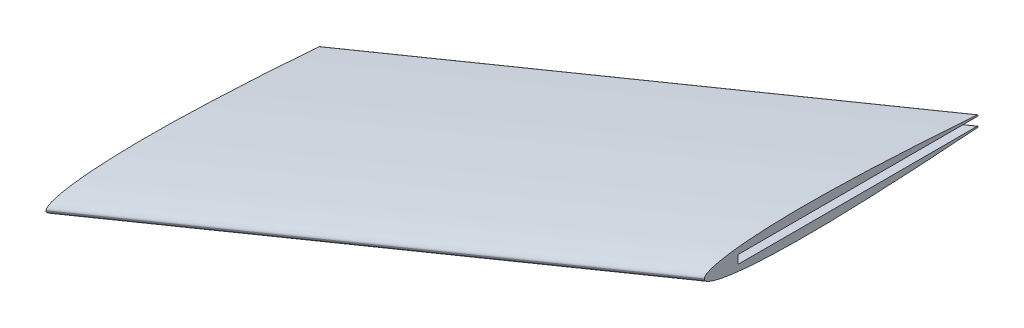
from build123d import *

# Parameters (mm, degrees)
CUT_FIN_SHAPE_BOTTOM_NO_MIDPLANE_DEPTH = 1.5875
CUT_FIN_SHAPE_TOP_NO_MIDPLANE_DEPTH    = 1.5875
FILLET1_R                              = 0.254


with BuildPart() as part:
    # Sketch2 → Loft1 section 0
    with BuildSketch(Plane(origin=(0, 0, 0), x_dir=(0, 0, -1), z_dir=(1, 0, 0))):
        with BuildLine():
            add(Edge.make_bspline(
                [(0, 0), (0.000112065, 0.073439068), (0.010533803, 0.168791942), (0.041645518, 0.288902736), (0.107597774, 0.439525442), (0.174952207, 0.557471143), (0.274605396, 0.694305527), (0.423192142, 0.856629808), (0.641823294, 1.048872414), (0.988399569, 1.292586347), (1.579464455, 1.619683809), (2.670474863, 2.077810345), (4.745675371, 2.705977792), (8.776847948, 3.528016649), (15.021399033, 4.293675836), (23.191353615, 4.842736838), (32.764506157, 5.10276556), (42.702897842, 5.09770056), (52.639295771, 4.892817274), (61.329246407, 4.583212741), (68.775407771, 4.2448641), (74.977465649, 3.921753372), (79.939556563, 3.640422534), (86.136902176, 3.26312892), (92.33870589, 2.852563273), (98.527436199, 2.412616871), (104.730394057, 1.940750012), (109.666317163, 1.547214497), (114.030472447, 1.181617743), (117.691294321, 0.863323444), (120.870618328, 0.576745855), (123.168740708, 0.365752696), (125.300878628, 0.163634295), (126.437748607, 0.05448216), (127, 0)],
                knots=[0, 0, 0, 0, 0, 0.002066404, 0.00272166, 0.00349439, 0.00465466, 0.005910137, 0.007512176, 0.009723538, 0.012894752, 0.017904229, 0.026634222, 0.043223315, 0.074288463, 0.134448605, 0.204905617, 0.275362631, 0.345819646, 0.416276661, 0.486733677, 0.521962184, 0.557190692, 0.5924192, 0.627647708, 0.698104723, 0.733333231, 0.768561739, 0.803790246, 0.839018753, 0.856633007, 0.874247262, 0.891861516, 0.90947577, 0.90947577, 0.90947577, 0.90947577, 0.90947577], degree=4))
            add(Edge.make_bspline(
                [(0, 0), (0.000112065, -0.073439068), (0.010533803, -0.168791942), (0.041645518, -0.288902736), (0.107597774, -0.439525442), (0.174952207, -0.557471143), (0.274605396, -0.694305527), (0.423192142, -0.856629808), (0.641823294, -1.048872414), (0.988399569, -1.292586347), (1.579464455, -1.619683809), (2.670474863, -2.077810345), (4.745675371, -2.705977792), (8.776847948, -3.528016649), (15.021399033, -4.293675836), (23.191353615, -4.842736838), (32.764506157, -5.10276556), (42.702897842, -5.09770056), (52.639295771, -4.892817274), (61.329246407, -4.583212741), (68.775407771, -4.2448641), (74.977465649, -3.921753372), (79.939556563, -3.640422534), (86.136902176, -3.26312892), (92.33870589, -2.852563273), (98.527436199, -2.412616871), (104.730394057, -1.940750012), (109.666317163, -1.547214497), (114.030472447, -1.181617743), (117.691294321, -0.863323444), (120.870618328, -0.576745855), (123.168740708, -0.365752696), (125.300878628, -0.163634295), (126.437748607, -0.05448216), (127, 0)],
                knots=[0, 0, 0, 0, 0, 0.002066404, 0.00272166, 0.00349439, 0.00465466, 0.005910137, 0.007512176, 0.009723538, 0.012894752, 0.017904229, 0.026634222, 0.043223315, 0.074288463, 0.134448605, 0.204905617, 0.275362631, 0.345819646, 0.416276661, 0.486733677, 0.521962184, 0.557190692, 0.5924192, 0.627647708, 0.698104723, 0.733333231, 0.768561739, 0.803790246, 0.839018753, 0.856633007, 0.874247262, 0.891861516, 0.90947577, 0.90947577, 0.90947577, 0.90947577, 0.90947577], degree=4))
        make_face()
    # Sketch3 → Loft1 section 1
    with BuildSketch(Plane(origin=(146.05, 0, 0), x_dir=(0, 0, -1), z_dir=(1, 0, 0))):
        with BuildLine():
            add(Edge.make_bspline(
                [(101.6, 0), (101.600112065, 0.073439068), (101.610533803, 0.168791942), (101.641645518, 0.288902736), (101.707597774, 0.439525442), (101.774952207, 0.557471143), (101.874605396, 0.694305527), (102.023192142, 0.856629808), (102.241823294, 1.048872414), (102.588399569, 1.292586347), (103.179464455, 1.619683809), (104.270474863, 2.077810345), (106.345675371, 2.705977792), (110.376847948, 3.528016649), (116.621399033, 4.293675836), (124.791353615, 4.842736838), (134.364506157, 5.10276556), (144.302897842, 5.09770056), (154.239295771, 4.892817274), (162.929246407, 4.583212741), (170.375407771, 4.2448641), (176.577465649, 3.921753372), (181.539556563, 3.640422534), (187.736902176, 3.26312892), (193.93870589, 2.852563273), (200.127436199, 2.412616871), (206.330394057, 1.940750012), (211.266317163, 1.547214497), (215.630472447, 1.181617743), (219.291294321, 0.863323444), (222.470618328, 0.576745855), (224.768740708, 0.365752696), (226.900878628, 0.163634295), (228.037748607, 0.05448216), (228.6, 0)],
                knots=[0, 0, 0, 0, 0, 0.002066404, 0.00272166, 0.00349439, 0.00465466, 0.005910137, 0.007512176, 0.009723538, 0.012894752, 0.017904229, 0.026634222, 0.043223315, 0.074288463, 0.134448605, 0.204905617, 0.275362631, 0.345819646, 0.416276661, 0.486733677, 0.521962184, 0.557190692, 0.5924192, 0.627647708, 0.698104723, 0.733333231, 0.768561739, 0.803790246, 0.839018753, 0.856633007, 0.874247262, 0.891861516, 0.90947577, 0.90947577, 0.90947577, 0.90947577, 0.90947577], degree=4))
            add(Edge.make_bspline(
                [(101.6, 0), (101.600112065, -0.073439068), (101.610533803, -0.168791942), (101.641645518, -0.288902736), (101.707597774, -0.439525442), (101.774952207, -0.557471143), (101.874605396, -0.694305527), (102.023192142, -0.856629808), (102.241823294, -1.048872414), (102.588399569, -1.292586347), (103.179464455, -1.619683809), (104.270474863, -2.077810345), (106.345675371, -2.705977792), (110.376847948, -3.528016649), (116.621399033, -4.293675836), (124.791353615, -4.842736838), (134.364506157, -5.10276556), (144.302897842, -5.09770056), (154.239295771, -4.892817274), (162.929246407, -4.583212741), (170.375407771, -4.2448641), (176.577465649, -3.921753372), (181.539556563, -3.640422534), (187.736902176, -3.26312892), (193.93870589, -2.852563273), (200.127436199, -2.412616871), (206.330394057, -1.940750012), (211.266317163, -1.547214497), (215.630472447, -1.181617743), (219.291294321, -0.863323444), (222.470618328, -0.576745855), (224.768740708, -0.365752696), (226.900878628, -0.163634295), (228.037748607, -0.05448216), (228.6, 0)],
                knots=[0, 0, 0, 0, 0, 0.002066404, 0.00272166, 0.00349439, 0.00465466, 0.005910137, 0.007512176, 0.009723538, 0.012894752, 0.017904229, 0.026634222, 0.043223315, 0.074288463, 0.134448605, 0.204905617, 0.275362631, 0.345819646, 0.416276661, 0.486733677, 0.521962184, 0.557190692, 0.5924192, 0.627647708, 0.698104723, 0.733333231, 0.768561739, 0.803790246, 0.839018753, 0.856633007, 0.874247262, 0.891861516, 0.90947577, 0.90947577, 0.90947577, 0.90947577, 0.90947577], degree=4))
        make_face()
    loft()

    # Shape Of Fins → Cut Fin Shape - Bottom (No Midplane) (cut)
    with BuildSketch(Plane(origin=(0, 0, 0), x_dir=(1, 0, 0), z_dir=(0, 1, 0))):
        Polygon((0, 12.7), (146.05, 114.3), (146.05, 292.1), (0, 292.1), align=None)
    extrude(amount=-CUT_FIN_SHAPE_BOTTOM_NO_MIDPLANE_DEPTH, mode=Mode.SUBTRACT)

    # Shape Of Fins<2> → Cut Fin Shape - Top (No Midplane) (cut)
    with BuildSketch(Plane(origin=(0, 0, 0), x_dir=(1, 0, 0), z_dir=(0, 1, 0))):
        Polygon((0, 12.7), (146.05, 114.3), (146.05, 292.1), (0, 292.1), align=None)
    extrude(amount=CUT_FIN_SHAPE_TOP_NO_MIDPLANE_DEPTH, mode=Mode.SUBTRACT)

    # Fillet1
    fillet1_edges = [part.edges().sort_by_distance(p)[0] for p in [
        (73.025, 1.5875, -159.921086403),
        (73.025, -1.5875, -159.921086403),
    ]]
    fillet(fillet1_edges, radius=FILLET1_R)


solid = part.part
